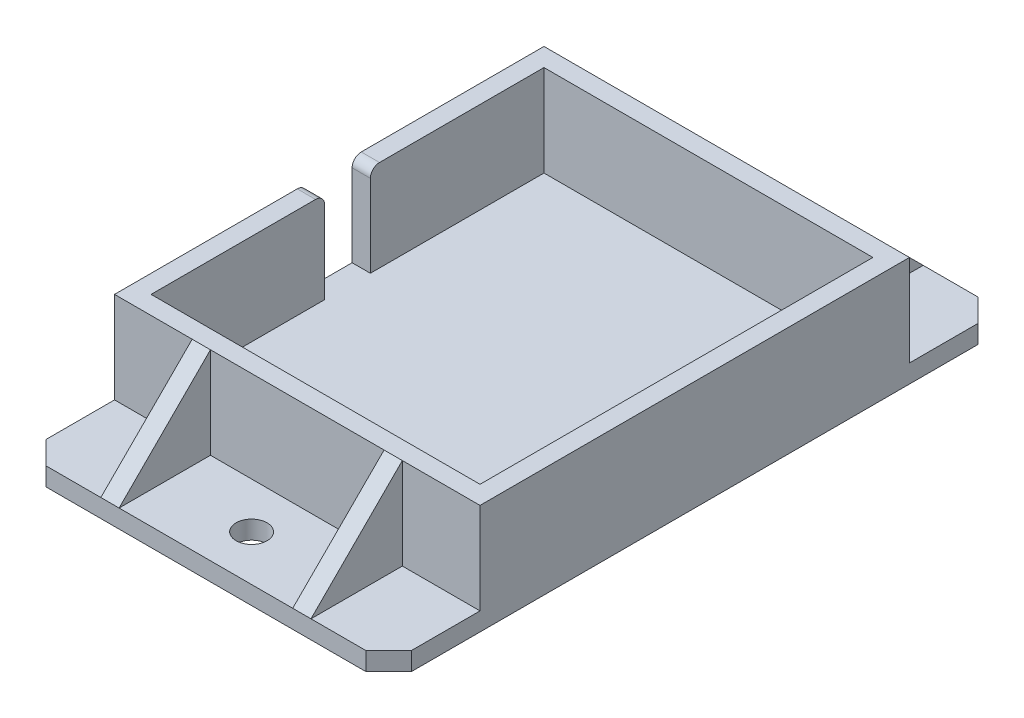
from build123d import *

# Parameters (mm, degrees)
SKETCH1_W               = 80
SKETCH1_H               = 94
SKETCH1_W_2             = 72
SKETCH1_H_2             = 86
BOSS_EXTRUDE3_DEPTH     = 20
SKETCH10_W              = 80
SKETCH10_H              = 134
BOSS_EXTRUDE4_DEPTH     = 4
CUT_EXTRUDE1_REACH      = 108.25
SKETCH11_W              = 10
SKETCH11_H              = 20
FILLET2_R               = 2
TAP_DRILL_FOR_M8_TAP2_D = 6.8
RIB10_REACH             = 94.79
SKETCH26_WALL_W         = 215.864442602
SKETCH26_WALL_H         = 4
MIRROR4_COPY_1_REACH    = 94.79
MIRROR4_COPY_1_SKETCH_W = 215.864442602
MIRROR4_COPY_1_SKETCH_H = 4
CHAMFER1_SIZE           = 5


with BuildPart() as part:
    # Sketch1 → Boss-Extrude3 (new body)
    with BuildSketch(Plane(origin=(0, 0, 0), x_dir=(1, 0, 0), z_dir=(0, 1, 0))):
        Rectangle(SKETCH1_W, SKETCH1_H)
        Rectangle(SKETCH1_W_2, SKETCH1_H_2, mode=Mode.SUBTRACT)
    extrude(amount=BOSS_EXTRUDE3_DEPTH)

    # Sketch10 → Boss-Extrude4 (add)
    with BuildSketch(Plane.XZ):
        Rectangle(SKETCH10_W, SKETCH10_H)
    extrude(amount=BOSS_EXTRUDE4_DEPTH)

    # Sketch11 → Cut-Extrude1 (cut, up to next)
    with BuildSketch(Plane.ZY.offset(40), mode=Mode.PRIVATE) as cut_extrude1_sk1:
        with Locations((0, 10)):
            Rectangle(SKETCH11_W, SKETCH11_H)
    cut_extrude1_tool1 = extrude(cut_extrude1_sk1.sketch, amount=-CUT_EXTRUDE1_REACH, mode=Mode.PRIVATE) & part.part
    add(cut_extrude1_tool1.solids().sort_by_distance((-40, 10, 0))[0], mode=Mode.SUBTRACT)

    # Fillet2
    fillet2_edges = [part.edges().sort_by_distance(p)[0] for p in [
        (-38, 20, -5),
        (-38, 20, 5),
    ]]
    fillet(fillet2_edges, radius=FILLET2_R)

    # Tap Drill for M8 Tap2 (through all)
    with Locations(Plane(origin=(0, 0, 57), x_dir=(0, 0, 1), z_dir=(0, 1, 0))):
        with Locations((0, 0), (-114, 0)):
            Hole(TAP_DRILL_FOR_M8_TAP2_D / 2)

    # Sketch26 wall → Rib10 (add, up to next)
    with BuildSketch(Plane(origin=(-21, 10, -57), x_dir=(0, 0.707106781187, 0.707106781187), z_dir=(0, 0.707106781187, -0.707106781187)), mode=Mode.PRIVATE) as rib10_sk1:
        Rectangle(SKETCH26_WALL_W, SKETCH26_WALL_H)
    rib10_tool1 = extrude(rib10_sk1.sketch, amount=-RIB10_REACH, mode=Mode.PRIVATE) - part.part
    rib10 = rib10_tool1.solids().sort_by_distance((-21, 10, -57))[0]
    add(rib10)

    # Mirror3: Rib10 across plane
    add(rib10.mirror(Plane(origin=(0, 0, 0), x_dir=(0, 0, 1), z_dir=(1, 0, 0))))

    # Mirror4: Rib10 across plane
    add(rib10.mirror(Plane.XY))

    # Mirror4 copy 1 sketch → Mirror4 copy 1 (add, up to next)
    with BuildSketch(Plane(origin=(21, 10, 57), x_dir=(0, 0.707106781187, -0.707106781187), z_dir=(0, 0.707106781187, 0.707106781187)), mode=Mode.PRIVATE) as mirror4_copy_1_sk1:
        Rectangle(MIRROR4_COPY_1_SKETCH_W, MIRROR4_COPY_1_SKETCH_H)
    mirror4_copy_1_tool1 = extrude(mirror4_copy_1_sk1.sketch, amount=-MIRROR4_COPY_1_REACH, mode=Mode.PRIVATE) - part.part
    add(mirror4_copy_1_tool1.solids().sort_by_distance((21, 10, 57))[0])

    # Chamfer1
    chamfer1_edges = [part.edges().sort_by_distance(p)[0] for p in [
        (40, -2, 67),
        (-40, -2, 67),
        (40, -2, -67),
        (-40, -2, -67),
    ]]
    chamfer(chamfer1_edges, length=CHAMFER1_SIZE)


solid = part.part
